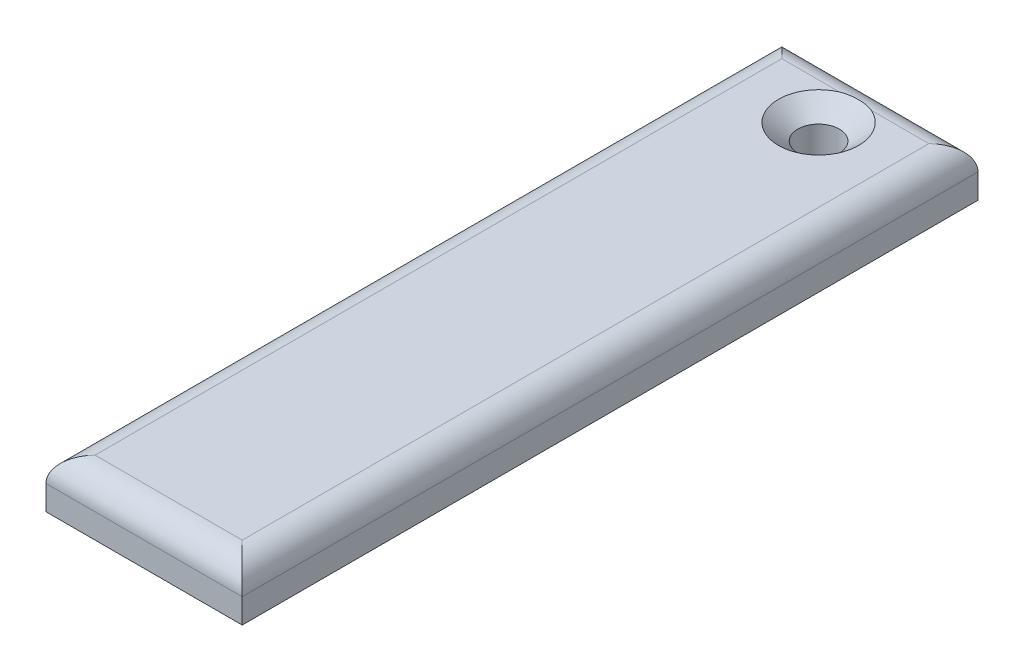
from build123d import *

# Parameters (mm, degrees)
SKETCH1_W                                         = 20.32
SKETCH1_H                                         = 76.2
BOSS_EXTRUDE1_DEPTH                               = 5.08
CSK_FOR_6_FLAT_HEAD_MACHINE_SCREW_100_D           = 4.3053
CSK_FOR_6_FLAT_HEAD_MACHINE_SCREW_100_CSINK_D     = 8.297418
CSK_FOR_6_FLAT_HEAD_MACHINE_SCREW_100_CSINK_ANGLE = 100
FILLET1_R                                         = 2.54


with BuildPart() as part:
    # Sketch1 → Boss-Extrude1 (new body)
    with BuildSketch(Plane(origin=(0, 0, 0), x_dir=(1, 0, 0), z_dir=(0, 1, 0))):
        Rectangle(SKETCH1_W, SKETCH1_H)
    extrude(amount=BOSS_EXTRUDE1_DEPTH)

    # CSK for #6 Flat Head Machine Screw (100)1 (through all)
    with Locations(Plane(origin=(0, 5.08, 0), x_dir=(1, 0, 0), z_dir=(0, 1, 0))):
        with Locations((0, 31.75)):
            CounterSinkHole(CSK_FOR_6_FLAT_HEAD_MACHINE_SCREW_100_D / 2, CSK_FOR_6_FLAT_HEAD_MACHINE_SCREW_100_CSINK_D / 2, counter_sink_angle=CSK_FOR_6_FLAT_HEAD_MACHINE_SCREW_100_CSINK_ANGLE)

    # Fillet1
    # the kernel refuses this fillet: 2.54 mm, written as the material it takes off along each edge
    with BuildSketch(Plane(origin=(-10.16, 5.08, -44.45), x_dir=(1, 0, 0), z_dir=(0, 0, 1)), Plane(origin=(10.16, 5.08, 44.45), x_dir=(-1, 0, 0), z_dir=(0, 0, -1))) as fillet1_piece_1:
        with BuildLine():
            CenterArc((FILLET1_R, -FILLET1_R), FILLET1_R, 90, 90)
            Line((0, -FILLET1_R), (0, 0))
            Line((0, 0), (FILLET1_R, 0))
        make_face()
    extrude(amount=88.9, mode=Mode.SUBTRACT)
    with BuildSketch(Plane(origin=(-16.51, 5.08, 38.1), x_dir=(0, -1, 0), z_dir=(1, 0, 0))) as fillet1_piece_2:
        with BuildLine():
            CenterArc((FILLET1_R, FILLET1_R), FILLET1_R, 180, 90)
            Line((0, FILLET1_R), (0, 0))
            Line((0, 0), (FILLET1_R, 0))
        make_face()
    extrude(amount=33.02, mode=Mode.SUBTRACT)
    with BuildSketch(Plane(origin=(16.51, 5.08, -38.1), x_dir=(0, 0, 1), z_dir=(-1, 0, 0))) as fillet1_piece_3:
        with BuildLine():
            CenterArc((FILLET1_R, -FILLET1_R), FILLET1_R, 90, 90)
            Line((0, -FILLET1_R), (0, 0))
            Line((0, 0), (FILLET1_R, 0))
        make_face()
    extrude(amount=33.02, mode=Mode.SUBTRACT)


solid = part.part
